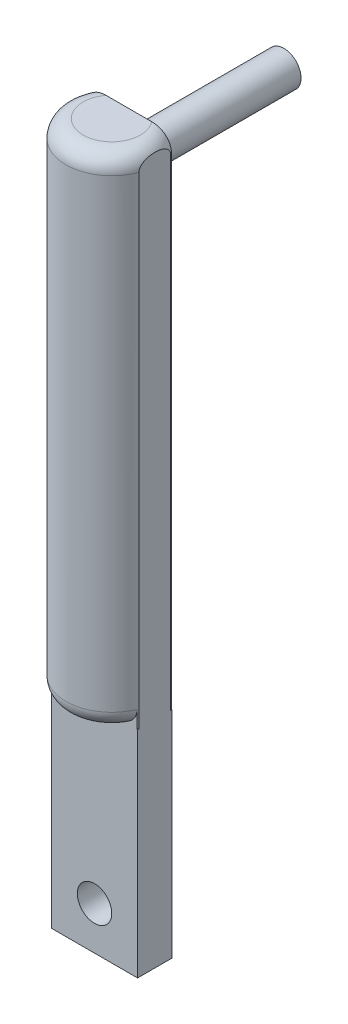
from build123d import *

# Parameters (mm, degrees)
ESQUISSE1_W        = 50
ESQUISSE1_H        = 125
ESQUISSE1_R        = 10
BOSS_EXTRU_1_DEPTH = 20
BOSS_EXTRU_2_DEPTH = 290
ESQUISSE4_R        = 10
BOSS_EXTRU_3_DEPTH = 90
CONG_1_R           = 10


with BuildPart() as part:
    # Esquisse1 → Boss.-Extru.1 (new body)
    with BuildSketch(Plane.XY):
        with Locations((0, -25)):
            Rectangle(ESQUISSE1_W, ESQUISSE1_H)
        with Locations((0, -62.5)):
            Circle(ESQUISSE1_R, mode=Mode.SUBTRACT)
    extrude(amount=BOSS_EXTRU_1_DEPTH)

    # Esquisse2 → Boss.-Extru.2 (add)
    with BuildSketch(Plane(origin=(0, 37.5, 0), x_dir=(1, 0, 0), z_dir=(0, 1, 0))):
        with BuildLine():
            ThreePointArc((25, -0.81456696), (24.846070853, -0.405994408), (24.685464957, 0))
            Line((24.685464957, 0), (-24.685464957, 0))
            ThreePointArc((-24.685464957, 0), (-24.846070853, -0.405994408), (-25, -0.81456696))
            Line((-25, -0.81456696), (-25, -19.18543304))
            ThreePointArc((-25, -19.18543304), (0, -36.634041753), (25, -19.18543304))
            Line((25, -19.18543304), (25, -0.81456696))
        make_face()
    extrude(amount=BOSS_EXTRU_2_DEPTH)

    # Esquisse4 → Boss.-Extru.3 (add)
    with BuildSketch(Plane(origin=(0, 0, 0), x_dir=(-1, 0, 0), z_dir=(0, 0, -1))):
        with Locations(Location((0, 302.814535043, 0), (0, 0, 180))):
            Circle(ESQUISSE4_R)
    extrude(amount=BOSS_EXTRU_3_DEPTH)

    # Congé1
    # the kernel refuses this fillet: 10 mm, written as the material it takes off along each edge
    with BuildSketch(Plane(origin=(0, 37.5, 10), x_dir=(-0.8501027120778188, 0, -0.5266169185640897), z_dir=(0.5266169185640897, 0, -0.8501027120778188))) as cong_1_piece_1_section:
        with BuildLine():
            CenterArc((26.634041753 - CONG_1_R, CONG_1_R), CONG_1_R, 270, 90)
            Line((26.634041753 - CONG_1_R, 0), (26.634041753, 0))
            Line((26.634041753, 0), (26.634041753, CONG_1_R))
        make_face()
    cong_1_piece_1 = revolve(axis=Axis((0, 37.5, 10), (0, 1, 0)), revolution_arc=243.554314658, mode=Mode.PRIVATE)
    cong_1_piece_1 = split(cong_1_piece_1, bisect_by=Plane(origin=(0, 40.353738925, 20), z_dir=(0, 0, 1)), keep=Keep.TOP, mode=Mode.PRIVATE)
    add(cong_1_piece_1, mode=Mode.SUBTRACT)
    with BuildSketch(Plane(origin=(0, 327.5, 10), x_dir=(-0.8323565470530717, 0, -0.5542405421636779), z_dir=(0.5542405421636779, 0, -0.8323565470530717))) as cong_1_piece_2:
        with BuildLine():
            CenterArc((26.634041753 - CONG_1_R, -CONG_1_R), CONG_1_R, 0, 90)
            Line((26.634041753, -CONG_1_R), (26.634041753, 0))
            Line((26.634041753, 0), (26.634041753 - CONG_1_R, 0))
        make_face()
    revolve(axis=Axis((0, 327.5, 10), (0, 1, 0)), revolution_arc=247.316842265, mode=Mode.SUBTRACT)
    with BuildSketch(Plane(origin=(0, 327.5, 10), x_dir=(0.8328594865150245, 0, 0.5534844855295674), z_dir=(-0.5534844855295674, 0, 0.8328594865150245))) as cong_1_piece_3:
        with BuildLine():
            CenterArc((26.634041753 - CONG_1_R, -CONG_1_R), CONG_1_R, 0, 90)
            Line((26.634041753, -CONG_1_R), (26.634041753, 0))
            Line((26.634041753, 0), (26.634041753 - CONG_1_R, 0))
        make_face()
    revolve(axis=Axis((0, 327.5, 10), (0, 1, 0)), revolution_arc=109.439699246, mode=Mode.SUBTRACT)
    with BuildSketch(Plane(origin=(0, 327.5, 10), x_dir=(-0.2447438061673637, 0, -0.9695877832061993), z_dir=(0.9695877832061993, 0, -0.2447438061673637))) as cong_1_piece_4:
        with BuildLine():
            CenterArc((26.634041753 - CONG_1_R, -CONG_1_R), CONG_1_R, 0, 90)
            Line((26.634041753 - CONG_1_R, 0), (26.634041753, 0))
            Line((26.634041753, 0), (26.634041753, -CONG_1_R))
        make_face()
    revolve(axis=Axis((0, 327.5, 10), (0, 1, 0)), revolution_arc=109.439699247, mode=Mode.SUBTRACT)


solid = part.part
